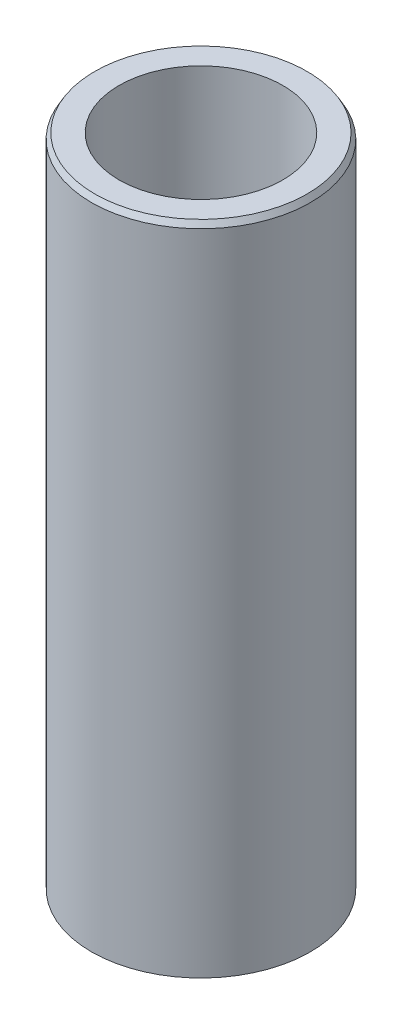
from build123d import *
from OCP.BRepFilletAPI import BRepFilletAPI_MakeChamfer

# Parameters (mm, degrees)
SKETCH1_R           = 15
BOSS_EXTRUDE1_DEPTH = 90.134639904
SKETCH2_R           = 11.218541308
CUT_EXTRUDE1_DEPTH  = 93.597264056
CHAMFER1_SIZE       = 0.790497804
CHAMFER1_SIZE2      = 0.45639412


with BuildPart() as part:
    # Sketch1 → Boss-Extrude1 (new body)
    with BuildSketch(Plane(origin=(0, 0, 0), x_dir=(1, 0, 0), z_dir=(0, 1, 0))):
        Circle(SKETCH1_R)
    extrude(amount=BOSS_EXTRUDE1_DEPTH)

    # Sketch2 → Cut-Extrude1 (cut, through all)
    with BuildSketch(Plane(origin=(0, 0, 0), x_dir=(1, 0, 0), z_dir=(0, 1, 0))):
        Circle(SKETCH2_R)
    extrude(amount=CUT_EXTRUDE1_DEPTH, mode=Mode.SUBTRACT)

    # Chamfer1: one chamfer whose edges measure the first distance from different faces: ONE call of the kernel's chamfer builder (chamfer() names one face for all edges)
    chamfer1_edges_1 = [part.edges().sort_by_distance(p)[0] for p in [
        (-15, 90.134639904, 0),
    ]]
    chamfer1_side_1 = [part.faces().sort_by_distance(p)[0] for p in [
        (-15, 45.067319952, 0),
    ]]
    chamfer1_edges_2 = [part.edges().sort_by_distance(p)[0] for p in [
        (-15, 0, 0),
    ]]
    chamfer1_side_2 = [part.faces().sort_by_distance(p)[0] for p in [
        (-14.575735931, 0, 0),
    ]]
    chamfer1 = BRepFilletAPI_MakeChamfer(part.part.solid().wrapped)
    for e in chamfer1_edges_1:
        chamfer1.Add(CHAMFER1_SIZE, CHAMFER1_SIZE2, e.wrapped, chamfer1_side_1[0].wrapped)  # the first distance lies on this face
    for e in chamfer1_edges_2:
        chamfer1.Add(CHAMFER1_SIZE, CHAMFER1_SIZE2, e.wrapped, chamfer1_side_2[0].wrapped)  # the first distance lies on this face
    add(Compound.cast(chamfer1.Shape()), mode=Mode.REPLACE)


solid = part.part
